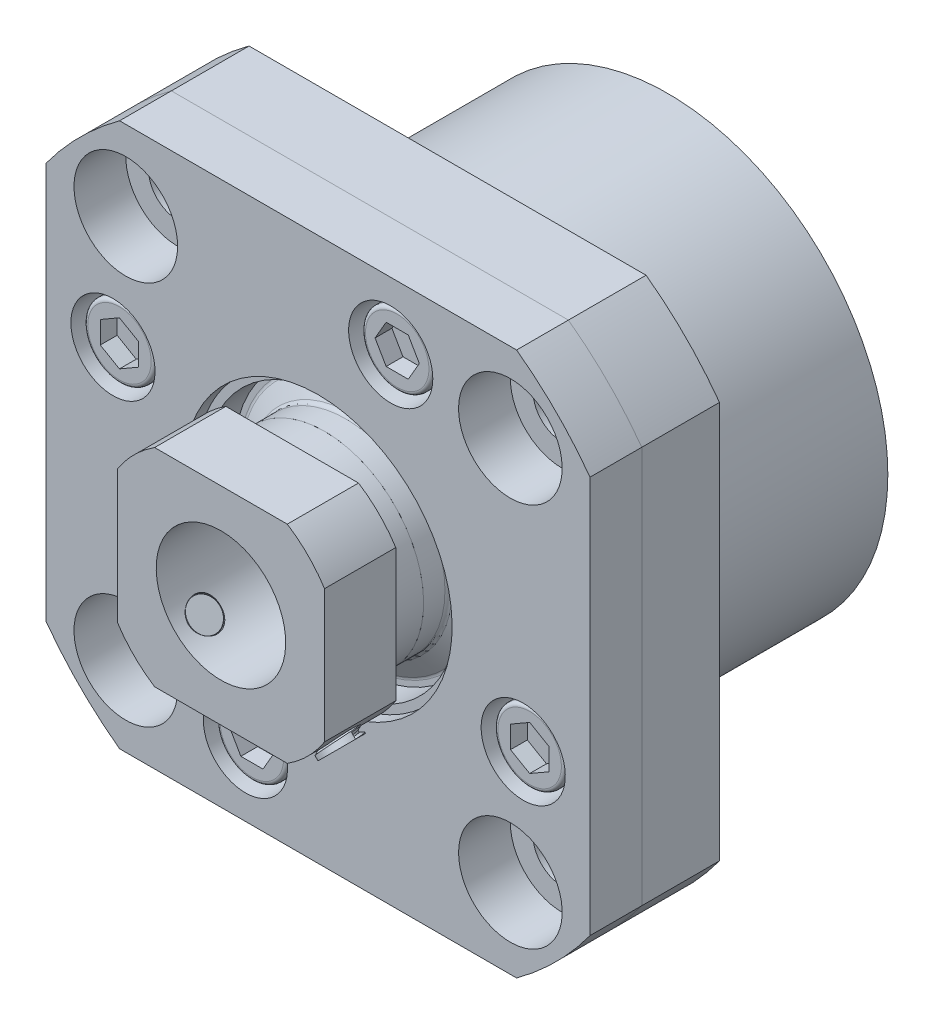
from build123d import *

# Parameters (mm, degrees)
SKIZZE3_OUTSIDE_W               = 69.668
SKIZZE3_OUTSIDE_H               = 69.668
SKIZZE3_OUTSIDE_W_2             = 42
SKIZZE3_OUTSIDE_H_2             = 42
SCHNITT_LINEAR_AUSTRAGEN1_DEPTH = 46.617978912
VERRUNDUNG1_R                   = 0.4
SKIZZE6_OUTSIDE_W               = 57.788
SKIZZE6_OUTSIDE_H               = 57.788
SKIZZE6_OUTSIDE_W_2             = 16
SKIZZE6_OUTSIDE_H_2             = 16
SCHNITT_LINEAR_AUSTRAGEN2_DEPTH = 5.5
KREISMUSTER1_COUNT              = 4
KREISMUSTER2_COUNT              = 4
SKIZZE12_W                      = 1.25
SKIZZE12_H                      = 11.313708499
AUFSATZ_LINEAR_START            = -0.5
SKIZZE14_R                      = 2.75
AUFSATZ_LINEAR_AUSTRAGEN1_DEPTH = 2.5
SCHNITT_LINEAR_AUSTRAGEN3_DEPTH = 1.3
VERRUNDUNG2_R                   = 0.3
KREISMUSTER4_COUNT              = 4
AUFSATZ_LINEAR_START_2          = -5
SKIZZE16_R                      = 1.5
AUFSATZ_LINEAR_AUSTRAGEN2_DEPTH = 5
FASE1_SIZE                      = 0.3
GEWINDE1_PITCH                  = 0.5
SCHNITT_LINEAR_AUSTRAGEN4_DEPTH = 1.2
KREISMUSTER6_COUNT              = 2
KREISMUSTER6_ANGLE              = 270


with BuildPart() as part:
    # Skizze1 → Rotation1 (revolve)
    with BuildSketch(Plane(origin=(0, 0, 0), x_dir=(0, 0, -1), z_dir=(1, 0, 0)), mode=Mode.PRIVATE) as rotation1_sk:
        Polygon((23, 10.35), (2, 10.35), (2, 13), (0, 13), (0, 26), (6, 26), (6, 17), (23, 17), align=None)
    revolve(rotation1_sk.sketch.rotate(Axis((0, 0, 0), (0, 0, -1)), 90), axis=Axis((0, 0, 0), (0, 0, -1)))


with BuildPart() as body_2:
    # Skizze2 → Rotation2 (revolve)
    with BuildSketch(Plane(origin=(0, 0, 0), x_dir=(0, 0, -1), z_dir=(1, 0, 0))):
        Polygon((2, 10.35), (-4, 10.35), (-4, 26), (0, 26), (0, 13), (2, 13), align=None)
    revolve(axis=Axis((0, 0, 0), (0, 0, 1)))


with BuildPart() as schnitt_linear_austragen1_tool:
    # Skizze3 outside → Schnitt-Linear austragen1 (new, through all)
    with BuildSketch(Plane.XY.offset(4)):
        Rectangle(SKIZZE3_OUTSIDE_W, SKIZZE3_OUTSIDE_H)
        Rectangle(SKIZZE3_OUTSIDE_W_2, SKIZZE3_OUTSIDE_H_2, mode=Mode.SUBTRACT)
    extrude(amount=-SCHNITT_LINEAR_AUSTRAGEN1_DEPTH)


with BuildPart() as part_1:
    add(part.part)

    # Schnitt-Linear austragen1: cut by schnitt_linear_austragen1_tool
    add(schnitt_linear_austragen1_tool.part, mode=Mode.SUBTRACT)


with BuildPart() as body_2_1:
    add(body_2.part)

    # Schnitt-Linear austragen1: cut by schnitt_linear_austragen1_tool
    add(schnitt_linear_austragen1_tool.part, mode=Mode.SUBTRACT)


with BuildPart() as body_3:
    # Skizze4 → Rotation3 (revolve)
    with BuildSketch(Plane(origin=(0, 0, 0), x_dir=(0, 0, -1), z_dir=(1, 0, 0)), mode=Mode.PRIVATE) as rotation3_sk:
        Polygon((23.5, 5), (-3.5, 5), (-3.5, 7.65), (-1.62, 7.65), (-0.73, 9.2), (-0.73, 9.72), (-3, 9.72), (-3, 10.35), (23, 10.35), (23, 9.72), (20.73, 9.72), (20.73, 9.2), (21.62, 7.65), (23.5, 7.65), align=None)
    revolve(rotation3_sk.sketch.rotate(Axis((0, 0, 3.5), (0, 0, -1)), 90), axis=Axis((0, 0, 3.5), (0, 0, -1)))

    # Verrundung1
    verrundung1_edges = [body_3.edges().sort_by_distance(p)[0] for p in [
        (-9.2, 0, -20.73),
        (-7.65, 0, 1.62),
        (-9.2, 0, 0.73),
        (-9.72, 0, -20.73),
    ]]
    fillet(verrundung1_edges, radius=VERRUNDUNG1_R)


with BuildPart() as body_4:
    # Skizze5 → Rotation4 (revolve)
    with BuildSketch(Plane(origin=(0, 0, 0), x_dir=(0, 0, -1), z_dir=(1, 0, 0))):
        Polygon((-3.5, 5), (-3.5, 7.65), (-6, 7.65), (-6, 9.5), (-11.5, 9.5), (-11.5, 5), align=None)
    revolve(axis=Axis((0, 0, 3.5), (0, 0, 1)))

    # Skizze6 outside → Schnitt-Linear austragen2 (cut)
    with BuildSketch(Plane.XY.offset(11.5)):
        Rectangle(SKIZZE6_OUTSIDE_W, SKIZZE6_OUTSIDE_H)
        Rectangle(SKIZZE6_OUTSIDE_W_2, SKIZZE6_OUTSIDE_H_2, mode=Mode.SUBTRACT)
    extrude(amount=-SCHNITT_LINEAR_AUSTRAGEN2_DEPTH, mode=Mode.SUBTRACT)

    # Skizze12 → M3 Gewindebohrung1 (revolve, cut)
    with BuildSketch(Plane(origin=(0, 0, 9.24), x_dir=(-0.7071067811865477, -0.7071067811865475, 0), z_dir=(0, 0, 1))):
        with Locations((0.625, 5.65685425)):
            Rectangle(SKIZZE12_W, SKIZZE12_H)
    m3_gewindebohrung1 = revolve(axis=Axis((-4.490128061, 4.490128061, 9.24), (0.7071067811865475, -0.7071067811865477, 0)), mode=Mode.SUBTRACT)

    # Spiegeln1: M3 Gewindebohrung1 across plane
    add(m3_gewindebohrung1.mirror(Plane(origin=(0, 0, 0), x_dir=(0, 0, 1), z_dir=(1, 0, 0))), mode=Mode.SUBTRACT)


with BuildPart() as stirnsenkung_f_r_m4_flachkopfschraube_mi_tool:
    # Skizze7 → Stirnsenkung für M4 Flachkopfschraube mit Schlitz1 (revolve)
    with BuildSketch(Plane(origin=(-14.849242405, 14.849242405, 4), x_dir=(0, -1, 0), z_dir=(1, 0, 0))):
        Polygon((0, 0), (0, 27.5), (2.25, 27.5), (2.25, 4), (4, 4), (4, 0), align=None)
    stirnsenkung_f_r_m4_flachkopfschraube_mi = revolve(axis=Axis((-14.849242405, 14.849242405, 10.35), (0, 0, -1)))


with BuildPart() as part_2:
    add(part_1.part)

    # Stirnsenkung für M4 Flachkopfschraube mit Schlitz1: cut by stirnsenkung_f_r_m4_flachkopfschraube_mi_tool
    add(stirnsenkung_f_r_m4_flachkopfschraube_mi_tool.part, mode=Mode.SUBTRACT)


with BuildPart() as body_2_2:
    add(body_2_1.part)

    # Stirnsenkung für M4 Flachkopfschraube mit Schlitz1: cut by stirnsenkung_f_r_m4_flachkopfschraube_mi_tool
    add(stirnsenkung_f_r_m4_flachkopfschraube_mi_tool.part, mode=Mode.SUBTRACT)


with BuildPart() as kreismuster1_tool:
    # Kreismuster1: Stirnsenkung für M4 Flachkopfschraube mit Schlitz1 ×4 about axis
    kreismuster1_axis = Axis((0, 0, 0), (0, 0, 1))
    for i in range(1, KREISMUSTER1_COUNT):
        add(stirnsenkung_f_r_m4_flachkopfschraube_mi.rotate(kreismuster1_axis, i * 360 / KREISMUSTER1_COUNT))


with BuildPart() as part_3:
    add(part_2.part)

    # Kreismuster1: cut by kreismuster1_tool
    add(kreismuster1_tool.part, mode=Mode.SUBTRACT)


with BuildPart() as body_2_3:
    add(body_2_2.part)

    # Kreismuster1: cut by kreismuster1_tool
    add(kreismuster1_tool.part, mode=Mode.SUBTRACT)


with BuildPart() as stirnsenkung_f_r_m3_zylinderschraube_mit_tool:
    # Skizze9 → Stirnsenkung für M3 Zylinderschraube mit Innensechskant1 (revolve)
    with BuildSketch(Plane(origin=(5.61, 15.84, 4), x_dir=(0, -1, 0), z_dir=(1, 0, 0))):
        Polygon((0, 0), (0, 10.021463052), (1.7, 9), (1.7, 3), (3.25, 3), (3.25, 0), align=None)
    stirnsenkung_f_r_m3_zylinderschraube_mit = revolve(axis=Axis((5.61, 15.84, 10.35), (0, 0, -1)))


with BuildPart() as part_4:
    add(part_3.part)

    # Stirnsenkung für M3 Zylinderschraube mit Innensechskant1: cut by stirnsenkung_f_r_m3_zylinderschraube_mit_tool
    add(stirnsenkung_f_r_m3_zylinderschraube_mit_tool.part, mode=Mode.SUBTRACT)


with BuildPart() as body_2_4:
    add(body_2_3.part)

    # Stirnsenkung für M3 Zylinderschraube mit Innensechskant1: cut by stirnsenkung_f_r_m3_zylinderschraube_mit_tool
    add(stirnsenkung_f_r_m3_zylinderschraube_mit_tool.part, mode=Mode.SUBTRACT)


with BuildPart() as kreismuster2_tool:
    # Kreismuster2: Stirnsenkung für M3 Zylinderschraube mit Innensechskant1 ×4 about axis
    kreismuster2_axis = Axis((0, 0, 0), (0, 0, 1))
    for i in range(1, KREISMUSTER2_COUNT):
        add(stirnsenkung_f_r_m3_zylinderschraube_mit.rotate(kreismuster2_axis, i * 360 / KREISMUSTER2_COUNT))


with BuildPart() as part_5:
    add(part_4.part)

    # Kreismuster2: cut by kreismuster2_tool
    add(kreismuster2_tool.part, mode=Mode.SUBTRACT)


with BuildPart() as body_2_5:
    add(body_2_4.part)

    # Kreismuster2: cut by kreismuster2_tool
    add(kreismuster2_tool.part, mode=Mode.SUBTRACT)


with BuildPart() as body_5:
    # Skizze14 → Aufsatz-Linear austragen1 (new body)
    with BuildSketch(Plane.XY.offset(4).offset(AUFSATZ_LINEAR_START)):
        with Locations((5.61, 15.84)):
            Circle(SKIZZE14_R)
    extrude(amount=-AUFSATZ_LINEAR_AUSTRAGEN1_DEPTH)

    # Skizze15 → Schnitt-Linear austragen3 (cut)
    with BuildSketch(Plane.XY.offset(3.5)):
        Polygon((6.464478398, 14.36), (7.318956797, 15.84), (6.464478398, 17.32), (4.755521602, 17.32), (3.901043203, 15.84), (4.755521602, 14.36), align=None)
    extrude(amount=-SCHNITT_LINEAR_AUSTRAGEN3_DEPTH, mode=Mode.SUBTRACT)

    # Verrundung2
    verrundung2_edges = [body_5.edges().sort_by_distance(p)[0] for p in [
        (2.86, 15.84, 3.5),
    ]]
    fillet(verrundung2_edges, radius=VERRUNDUNG2_R)


with BuildPart() as kreismuster4_1:
    # Kreismuster4: pattern copy
    add(body_5.part.rotate(Axis((0, 0, 0), (0, 0, 1)), 1 * 360 / KREISMUSTER4_COUNT))


with BuildPart() as kreismuster4_2:
    # Kreismuster4: pattern copy
    add(body_5.part.rotate(Axis((0, 0, 0), (0, 0, 1)), 2 * 360 / KREISMUSTER4_COUNT))


with BuildPart() as kreismuster4_3:
    # Kreismuster4: pattern copy
    add(body_5.part.rotate(Axis((0, 0, 0), (0, 0, 1)), 3 * 360 / KREISMUSTER4_COUNT))


with BuildPart() as body_9:
    # Skizze16 → Aufsatz-Linear austragen2 (new body)
    with BuildSketch(Plane(origin=(0, 0, 0), x_dir=(0.7071067811865477, 0.7071067811865475, 0), z_dir=(-0.7071067811865475, 0.7071067811865477, 0)).offset(AUFSATZ_LINEAR_START_2)):
        with Locations(Location((0, -9.24, 0), (0, 0, 180))):
            Circle(SKIZZE16_R)
    extrude(amount=-AUFSATZ_LINEAR_AUSTRAGEN2_DEPTH)

    # Fase1
    fase1_edges = [body_9.edges().sort_by_distance(p)[0] for p in [
        (4.596194078, -2.474873734, 9.24),
    ]]
    chamfer(fase1_edges, length=FASE1_SIZE)

    # Gewinde1: the profile of Gewindeprofil1 profile screwed along a right-hand helix of 20 turns, 6 arcs to a turn; built about Z, then put on its axis
    gewinde1_z = Axis((0, 0, 0), (0, 0, 1))
    gewinde1_corners = [(1.5003, 0, -0.000173205), (1.5003, 0, 0.437673204), (1.229367062, 0, 0.28125), (1.229367062, 0, 0.15625)]
    with BuildLine(mode=Mode.PRIVATE) as gewinde1_profile:
        Line(gewinde1_corners[0], gewinde1_corners[1])
        Line(gewinde1_corners[1], gewinde1_corners[2])
        Line(gewinde1_corners[2], gewinde1_corners[3])
        Line(gewinde1_corners[3], gewinde1_corners[0])
    gewinde1_cap = Face(gewinde1_profile.wire())
    gewinde1_turn_angles = [0, 30, 60, 90, 120, 150, 180, 210, 240, 270, 300, 330, 360]
    gewinde1_turn_weights = [1, 0.8660254037844387, 1, 0.8660254037844387, 1, 0.8660254037844387, 1, 0.8660254037844387, 1, 0.8660254037844387, 1, 0.8660254037844387, 1]
    gewinde1_turn_rails = [Edge.make_bspline([Vector(p[0], p[1], 0).rotate(gewinde1_z, gewinde1_turn_angles[k]) / gewinde1_turn_weights[k] + Vector(0, 0, p[2] + GEWINDE1_PITCH * gewinde1_turn_angles[k] / 360) for k in range(13)], [0, 0, 0, 1, 1, 2, 2, 3, 3, 4, 4, 5, 5, 6, 6, 6], 2, gewinde1_turn_weights) for p in gewinde1_corners]
    gewinde1_turn_sides = [Face.make_surface_from_curves(gewinde1_turn_rails[p[0]], gewinde1_turn_rails[p[1]]) for p in [(0, 1), (1, 2), (2, 3), (3, 0)]]
    gewinde1 = Plane(origin=(7.071067812, -7.071067812, 9.24), x_dir=(0.707106781, 0.707106781, 0), z_dir=(-0.707106781, 0.707106781, 0)) * Solid(Shell([*[p.moved(Location((0, 0, GEWINDE1_PITCH * i))) for i in range(20) for p in gewinde1_turn_sides], gewinde1_cap, gewinde1_cap.rotate(gewinde1_z, 7200).moved(Location((0, 0, GEWINDE1_PITCH * 7200 / 360)))]))
    add(gewinde1, mode=Mode.SUBTRACT)

    # Skizze20 → Schnitt-Linear austragen4 (cut)
    with BuildSketch(Plane(origin=(7.071067812, -7.071067812, 0), x_dir=(0, 0, -1), z_dir=(0.7071067811865476, -0.7071067811865476, 0))):
        Polygon((-8.805, -0.753442101), (-8.37, 0), (-8.805, 0.753442101), (-9.675, 0.753442101), (-10.11, 0), (-9.675, -0.753442101), align=None)
    extrude(amount=-SCHNITT_LINEAR_AUSTRAGEN4_DEPTH, mode=Mode.SUBTRACT)


with BuildPart() as kreismuster6_1:
    # Kreismuster6: pattern copy
    add(body_9.part.rotate(Axis((0, 0, 3.5), (0, 0, 1)), 1 * KREISMUSTER6_ANGLE / (KREISMUSTER6_COUNT - 1)))


solid = Compound([body_3.part, body_4.part, part_5.part, body_2_5.part, body_5.part, kreismuster4_1.part, kreismuster4_2.part, kreismuster4_3.part, body_9.part, kreismuster6_1.part])
